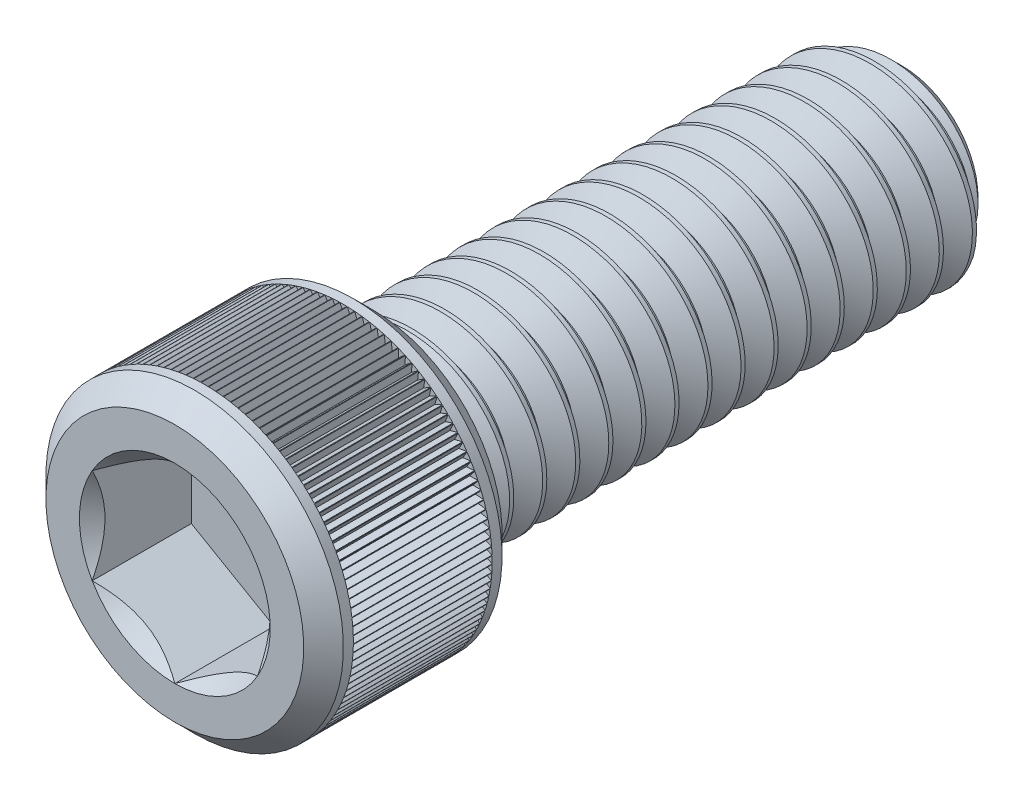
from build123d import *

# Parameters (mm, degrees)
CUT_EXTRUDE1_DEPTH = 4.7625
CUT_SWEEP1_PITCH   = 1.5875
CUT_SWEEP1_TO      = 25.4
CUT_EXTRUDE4_DEPTH = 3.33375
CIRPATTERN1_COUNT  = 125


with BuildPart() as part:
    # Sketch3 → Revolve1 (revolve)
    with BuildSketch(Plane(origin=(0, 0, 0), x_dir=(0, 0, -1), z_dir=(1, 0, 0))):
        Polygon((17.4625, 0), (-17.4625, 0), (-17.4625, 6.19125), (-16.51, 7.14375), (-8.89, 7.14375), (-7.9375, 6.19125), (-7.9375, 4.7625), (16.35125, 4.7625), (17.4625, 3.65125), align=None)
    revolve(axis=Axis((0, 0, -17.4625), (0, 0, 1)))

    # Sketch4 → Cut-Extrude1 (cut)
    with BuildSketch(Plane.XY.offset(17.4625)):
        Polygon((0, -4.582717762), (3.96875, -2.291358881), (3.96875, 2.291358881), (0, 4.582717762), (-3.96875, 2.291358881), (-3.96875, -2.291358881), align=None)
    extrude(amount=-CUT_EXTRUDE1_DEPTH, mode=Mode.SUBTRACT)

    # Cut-Extrude3 cone 1 section (through the dimple's axis) → Cut-Extrude3 (revolve, cut)
    with BuildSketch(Plane(origin=(0, 0, 17.4625), x_dir=(0, -1, 0), z_dir=(1, 0, 0))):
        Polygon((0, 0), (4.582717762, 0), (0, 4.582717762), align=None)
    revolve(axis=Axis((0, 0, 17.4625), (0, 0, -1)), mode=Mode.SUBTRACT)


with BuildPart() as body_2:
    # Split1: read off the stored shape, not the designer's step
    # Split1: the piece on the far side of the plane
    add(part.part)
    split(bisect_by=Plane.XY.offset(7.9375), keep=Keep.BOTTOM)

    # Cut-Sweep1: arcs per turn and ends read off the stored shape
    # Cut-Sweep1: the profile of Sketch7 screwed along a right-hand helix through 17 turns, 8 arcs to a turn; built about Z, then put on its axis
    cut_sweep1_z = Axis((0, 0, 0), (0, 0, 1))
    cut_sweep1_corners = [(4.848425958, 0, 0.049609375), (4.848425958, 0, -1.438671875), (3.731388504, 0, -0.79375), (3.731388504, 0, -0.5953125)]
    with BuildLine(mode=Mode.PRIVATE) as cut_sweep1_profile:
        Line(cut_sweep1_corners[0], cut_sweep1_corners[1])
        Line(cut_sweep1_corners[1], cut_sweep1_corners[2])
        Line(cut_sweep1_corners[2], cut_sweep1_corners[3])
        Line(cut_sweep1_corners[3], cut_sweep1_corners[0])
    cut_sweep1_cap = Face(cut_sweep1_profile.wire())
    cut_sweep1_turn_angles = [0, 22.5, 45, 67.5, 90, 112.5, 135, 157.5, 180, 202.5, 225, 247.5, 270, 292.5, 315, 337.5, 360]
    cut_sweep1_turn_weights = [1, 0.9238795325112867, 1, 0.9238795325112867, 1, 0.9238795325112867, 1, 0.9238795325112867, 1, 0.9238795325112867, 1, 0.9238795325112867, 1, 0.9238795325112867, 1, 0.9238795325112867, 1]
    cut_sweep1_turn_rails = [Edge.make_bspline([Vector(p[0], p[1], 0).rotate(cut_sweep1_z, cut_sweep1_turn_angles[k]) / cut_sweep1_turn_weights[k] + Vector(0, 0, p[2] + CUT_SWEEP1_PITCH * cut_sweep1_turn_angles[k] / 360) for k in range(17)], [0, 0, 0, 1, 1, 2, 2, 3, 3, 4, 4, 5, 5, 6, 6, 7, 7, 8, 8, 8], 2, cut_sweep1_turn_weights) for p in cut_sweep1_corners]
    cut_sweep1_turn_sides = [Face.make_surface_from_curves(cut_sweep1_turn_rails[p[0]], cut_sweep1_turn_rails[p[1]]) for p in [(0, 1), (1, 2), (2, 3), (3, 0)]]
    cut_sweep1 = Plane(origin=(0, 0, -17.4625), x_dir=(0, 1, 0), z_dir=(0, 0, 1)) * split(Solid(Shell([*[p.moved(Location((0, 0, CUT_SWEEP1_PITCH * i))) for i in range(17) for p in cut_sweep1_turn_sides], cut_sweep1_cap, cut_sweep1_cap.rotate(cut_sweep1_z, 6120).moved(Location((0, 0, CUT_SWEEP1_PITCH * 6120 / 360)))])), bisect_by=Plane.XY.offset(CUT_SWEEP1_TO), keep=Keep.BOTTOM, mode=Mode.PRIVATE)
    add(cut_sweep1, mode=Mode.SUBTRACT)


with BuildPart() as part_1:
    add(part.part)

    # Split1
    split(bisect_by=Plane.XY.offset(7.9375), keep=Keep.TOP)

    add(body_2.part)  # Boss-Extrude1 merges body 2
    # Boss-Extrude1 cone 1 section (through the dimple's axis) → Boss-Extrude1 (revolve)
    with BuildSketch(Plane(origin=(0, 0, 7.9375), x_dir=(0, -1, 0), z_dir=(1, 0, 0))):
        Polygon((0, 0), (4.7625, 0), (0, 0.839757246), align=None)
    revolve(axis=Axis((0, 0, 7.9375), (0, 0, -1)))

    # Sketch9 → Cut-Extrude4 (cut, symmetric)
    with BuildSketch(Plane.XY.offset(12.7)):
        with BuildLine():
            Line((-0.165663432, 7.141828876), (0, 6.7865625))
            Line((0, 6.7865625), (0.165663432, 7.141828876))
            ThreePointArc((0.165663432, 7.141828876), (0, 7.14375), (-0.165663432, 7.141828876))
        make_face()
    cut_extrude4 = extrude(amount=CUT_EXTRUDE4_DEPTH, both=True, mode=Mode.SUBTRACT)

    # CirPattern1: Cut-Extrude4 ×125 about axis
    cirpattern1_axis = Axis((0, 0, 0), (0, 0, 1))
    for i in range(1, CIRPATTERN1_COUNT):
        add(cut_extrude4.rotate(cirpattern1_axis, i * 360 / CIRPATTERN1_COUNT), mode=Mode.SUBTRACT)


solid = part_1.part
